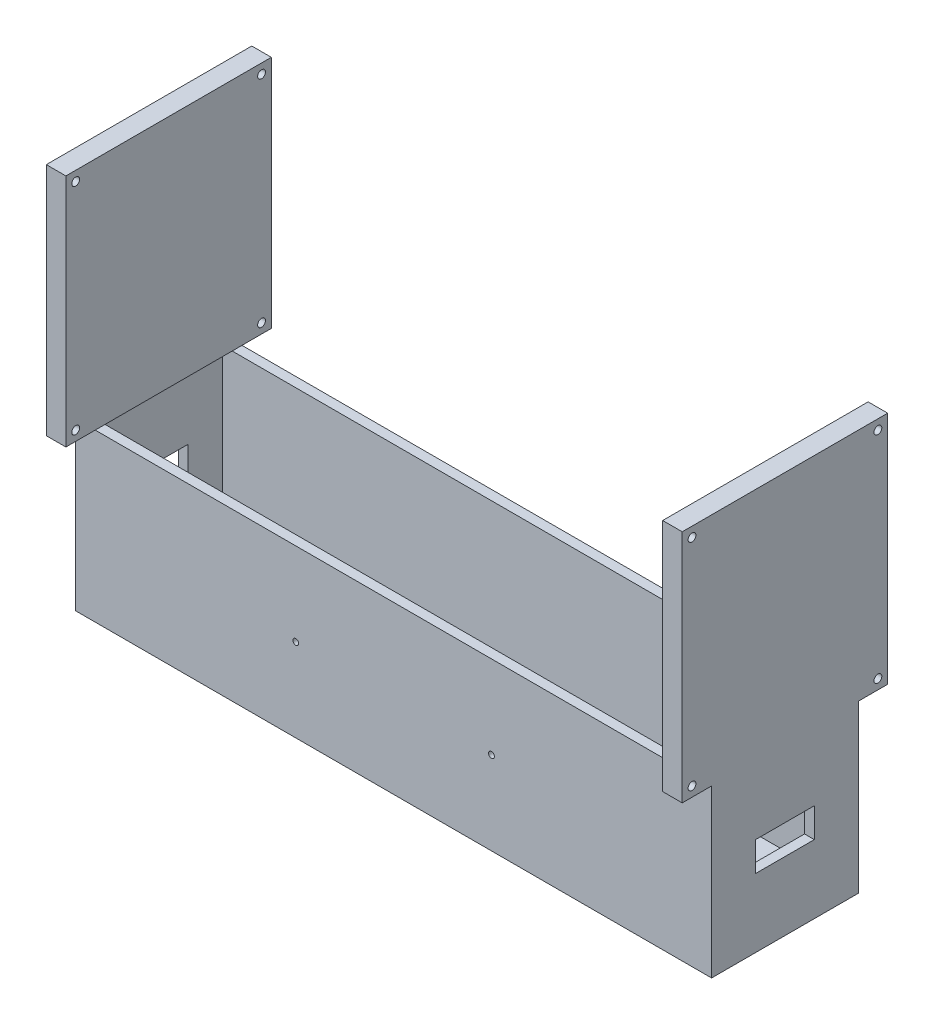
from build123d import *

# Parameters (mm, degrees)
SKETCH1_W           = 325
SKETCH1_H           = 75
BOSS_EXTRUDE1_DEPTH = 42.5
SKETCH2_R           = 1.5
CUT_EXTRUDE1_DEPTH  = 10
SKETCH3_W           = 10
SKETCH3_H           = 105
BOSS_EXTRUDE2_DEPTH = 120
SHELL1_START        = -32.5
SHELL1_OUTLINE_W    = 315
SHELL1_OUTLINE_H    = 80
SHELL1_OUTLINE_R    = 6.5
SHELL1_DEPTH        = 65
SHELL1_2_OUTLINE_R  = 6.5
SHELL1_2_DEPTH      = 55
SKETCH4_W           = 30
SKETCH4_H           = 15
CUT_EXTRUDE2_DEPTH  = 368.134171659
SKETCH5_R           = 2
CUT_EXTRUDE3_DEPTH  = 368.134171659


# Read off the part's stored shape, not the designer's step: Shell1
with BuildPart() as part:
    # Sketch1 → Boss-Extrude1 (new, symmetric)
    with BuildSketch(Plane(origin=(0, 0, 0), x_dir=(1, 0, 0), z_dir=(0, 1, 0))):
        Rectangle(SKETCH1_W, SKETCH1_H)
    extrude(amount=BOSS_EXTRUDE1_DEPTH, both=True)

    # Sketch2 → Cut-Extrude1 (cut)
    with BuildSketch(Plane.XY.offset(37.5)):
        with Locations((-50, 0)):
            Circle(SKETCH2_R)
        with Locations(Location((50, 0, 0), (0, 0, 180))):
            Circle(SKETCH2_R)
    extrude(amount=-CUT_EXTRUDE1_DEPTH, mode=Mode.SUBTRACT)

    # Sketch3 → Boss-Extrude2 (add)
    with BuildSketch(Plane(origin=(0, 42.5, 0), x_dir=(1, 0, 0), z_dir=(0, 1, 0))):
        with Locations((-157.5, 0)):
            Rectangle(SKETCH3_W, SKETCH3_H)
    boss_extrude2 = extrude(amount=BOSS_EXTRUDE2_DEPTH)

    # Mirror1: Boss-Extrude2 across plane
    add(boss_extrude2.mirror(Plane(origin=(0, 0, 0), x_dir=(0, 0, 1), z_dir=(1, 0, 0))))

    # Shell1 outline → Shell1 (cut)
    with BuildSketch(Plane.XY.offset(SHELL1_START)):
        with Locations((0, 2.5)):
            Rectangle(SHELL1_OUTLINE_W, SHELL1_OUTLINE_H)
        with Locations((-50, 0)):
            Circle(SHELL1_OUTLINE_R, mode=Mode.SUBTRACT)
        with Locations((50, 0)):
            Circle(SHELL1_OUTLINE_R, mode=Mode.SUBTRACT)
    extrude(amount=SHELL1_DEPTH, mode=Mode.SUBTRACT)

    # Shell1 2 outline → Shell1 2 (cut)
    with BuildSketch(Plane.XY.offset(SHELL1_START)):
        with Locations((50, 0)):
            Circle(SHELL1_2_OUTLINE_R)
        with Locations((-50, 0)):
            Circle(SHELL1_2_OUTLINE_R)
    extrude(amount=SHELL1_2_DEPTH, mode=Mode.SUBTRACT)

    # Sketch4 → Cut-Extrude2 (cut, through all)
    with BuildSketch(Plane(origin=(162.5, 0, 0), x_dir=(0, 0, -1), z_dir=(1, 0, 0))):
        Rectangle(SKETCH4_W, SKETCH4_H)
    extrude(amount=-CUT_EXTRUDE2_DEPTH, mode=Mode.SUBTRACT)

    # Sketch5 → Cut-Extrude3 (cut, through all)
    with BuildSketch(Plane(origin=(162.5, 0, 0), x_dir=(0, 0, -1), z_dir=(1, 0, 0))):
        with Locations((-47.5, 47.5)):
            Circle(SKETCH5_R)
        with Locations((47.5, 47.5)):
            Circle(SKETCH5_R)
        with Locations((47.5, 157.5)):
            Circle(SKETCH5_R)
        with Locations((-47.5, 157.5)):
            Circle(SKETCH5_R)
    extrude(amount=-CUT_EXTRUDE3_DEPTH, mode=Mode.SUBTRACT)


solid = part.part
